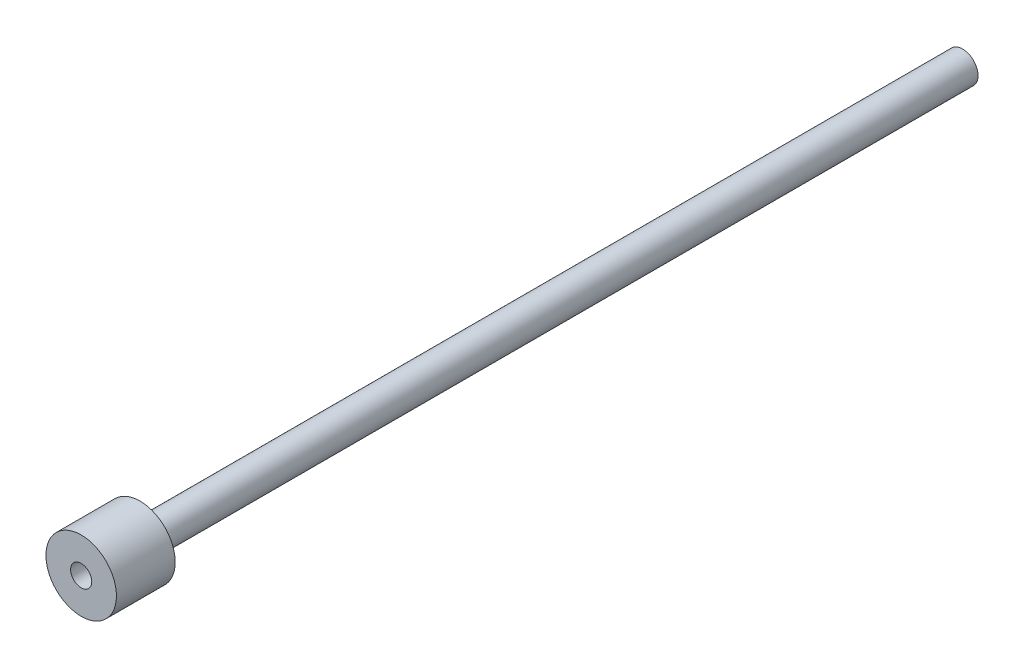
from build123d import *
from build123d.topology import SkipClean

# Parameters (mm, degrees)
SKETCH1_R           = 12
BOSS_EXTRUDE1_DEPTH = 20
SKETCH2_R           = 9.5
SKETCH2_R_2         = 5.25
CUT_EXTRUDE1_DEPTH  = 15
SKETCH3_R           = 3.6
CUT_EXTRUDE2_DEPTH  = 27.229754097
SKETCH4_R           = 5.25
SKETCH4_R_2         = 3.6
BOSS_EXTRUDE2_DEPTH = 280


with BuildPart() as part:
    # Sketch1 → Boss-Extrude1 (new body)
    with BuildSketch(Plane.XY):
        Circle(SKETCH1_R)
    extrude(amount=BOSS_EXTRUDE1_DEPTH)

    # Sketch2 → Cut-Extrude1 (cut)
    with BuildSketch(Plane(origin=(0, 0, 0), x_dir=(-1, 0, 0), z_dir=(0, 0, -1))):
        Circle(SKETCH2_R)
        Circle(SKETCH2_R_2, mode=Mode.SUBTRACT)
    extrude(amount=-CUT_EXTRUDE1_DEPTH, mode=Mode.SUBTRACT)

    # Sketch3 → Cut-Extrude2 (cut, through all)
    with BuildSketch(Plane.XY.offset(20)):
        Circle(SKETCH3_R)
    extrude(amount=-CUT_EXTRUDE2_DEPTH, mode=Mode.SUBTRACT)

    # Sketch4 → Boss-Extrude2 (add)
    with SkipClean():  # the faces are left unmerged after this step: merging them gives an invalid solid
        with BuildSketch(Plane(origin=(0, 0, 0), x_dir=(-1, 0, 0), z_dir=(0, 0, -1))):
            Circle(SKETCH4_R)
            Circle(SKETCH4_R_2, mode=Mode.SUBTRACT)
        extrude(amount=BOSS_EXTRUDE2_DEPTH)


solid = part.part
